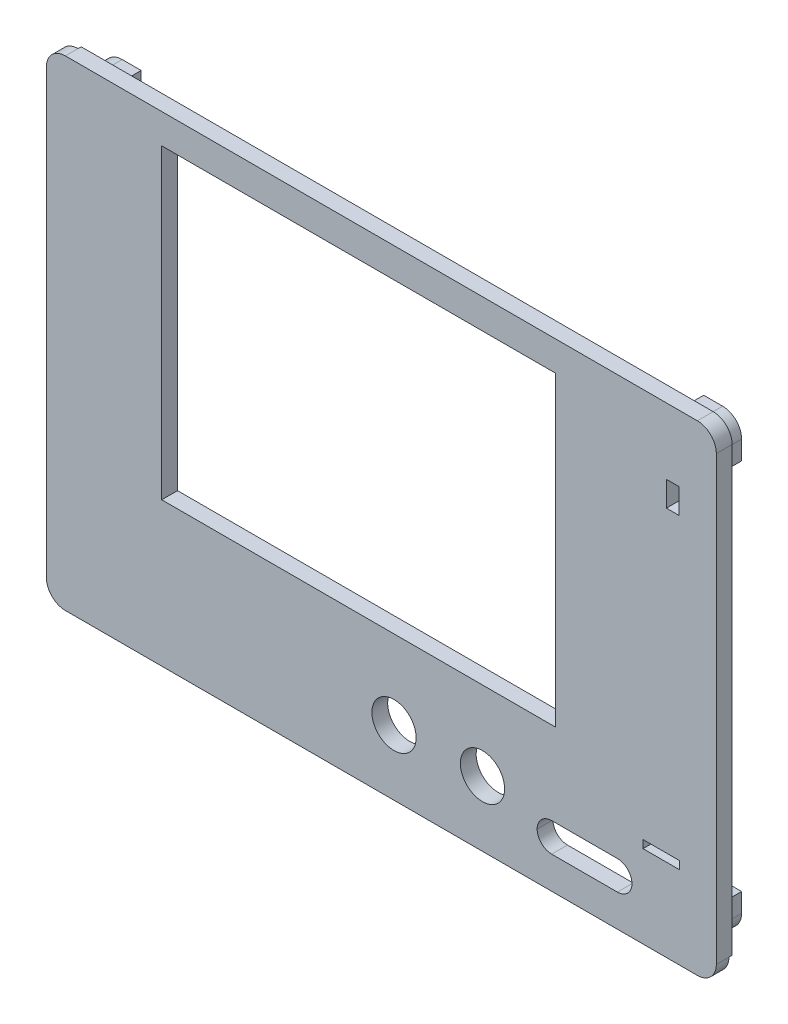
from build123d import *

# Parameters (mm, degrees)
IZIM1_W                     = 106
IZIM1_H                     = 76
IZIM1_R                     = 3.5
Y_KSEKLIK_EKSTR_ZYON2_DEPTH = 2.5
IZIM5_W                     = 62.3
IZIM5_H                     = 48.5
KES_EKSTR_ZYON1_DEPTH       = 2.5
Y_KSEKLIK_EKSTR_ZYON6_DEPTH = 4
RADYUS7_R                   = 3
RADYUS15_R                  = 3
IZIM12_W                    = 15
IZIM12_H                    = 4.6
IZIM12_W_2                  = 5.8
IZIM12_H_2                  = 1.25
IZIM12_W_3                  = 2
IZIM12_H_3                  = 3.95
KES_EKSTR_ZYON3_DEPTH       = 4
RADYUS16_R                  = 2.3
KES_EKSTR_ZYON5_START       = -0.5
KES_EKSTR_ZYON5_DEPTH       = 0.5
RADYUS17_R                  = 1.5


with BuildPart() as part:
    # Çizim1 → Yükseklik-Ekstrüzyon2 (new body)
    with BuildSketch(Plane.XY):
        with Locations((53, 38)):
            Rectangle(IZIM1_W, IZIM1_H)
        with Locations((55, 10.31)):
            Circle(IZIM1_R, mode=Mode.SUBTRACT)
        with Locations((69, 10.31)):
            Circle(IZIM1_R, mode=Mode.SUBTRACT)
    extrude(amount=Y_KSEKLIK_EKSTR_ZYON2_DEPTH)

    # Çizim5 → Kes-Ekstrüzyon1 (cut)
    with BuildSketch(Plane.XY.offset(2.5)):
        with Locations((49.4, 47.05)):
            Rectangle(IZIM5_W, IZIM5_H)
    extrude(amount=-KES_EKSTR_ZYON1_DEPTH, mode=Mode.SUBTRACT)

    # Çizim7 → Yükseklik-Ekstrüzyon6 (add)
    with BuildSketch(Plane(origin=(0, 0, 0), x_dir=(-1, 0, 0), z_dir=(0, 0, -1))):
        Polygon((-103.5, 73.5), (-97.5, 73.5), (-97.5, 71), (-101, 71), (-101, 67.5), (-103.5, 67.5), align=None)
        Polygon((-2.5, 2.5), (-8.5, 2.5), (-8.5, 5), (-5, 5), (-5, 8.5), (-2.5, 8.5), align=None)
        Polygon((-2.5, 67.5), (-2.5, 73.5), (-8.5, 73.5), (-8.5, 71), (-5, 71), (-5, 67.5), align=None)
        Polygon((-103.5, 8.5), (-103.5, 2.5), (-97.5, 2.5), (-97.5, 5), (-101, 5), (-101, 8.5), align=None)
    extrude(amount=Y_KSEKLIK_EKSTR_ZYON6_DEPTH)

    # Radyus7
    radyus7_edges = [part.edges().sort_by_distance(p)[0] for p in [
        (2.5, 2.5, -2),
        (2.5, 73.5, -2),
        (103.5, 2.5, -2),
        (103.5, 73.5, -2),
    ]]
    fillet(radyus7_edges, radius=RADYUS7_R)

    # Radyus15
    radyus15_edges = [part.edges().sort_by_distance(p)[0] for p in [
        (0, 76, 1.25),
        (106, 76, 1.25),
        (106, 0, 1.25),
        (0, 0, 1.25),
    ]]
    fillet(radyus15_edges, radius=RADYUS15_R)

    # Çizim12 → Kes-Ekstrüzyon3 (cut)
    with BuildSketch(Plane.XY.offset(2.5)):
        with Locations((85.15, 7.39)):
            Rectangle(IZIM12_W, IZIM12_H)
        with Locations((97.3, 13.695)):
            Rectangle(IZIM12_W_2, IZIM12_H_2)
        with Locations((99.1, 63.555)):
            Rectangle(IZIM12_W_3, IZIM12_H_3)
    extrude(amount=-KES_EKSTR_ZYON3_DEPTH, mode=Mode.SUBTRACT)

    # Radyus16
    radyus16_edges = [part.edges().sort_by_distance(p)[0] for p in [
        (92.65, 5.09, 1.25),
        (92.65, 9.69, 1.25),
        (77.65, 9.69, 1.25),
        (77.65, 5.09, 1.25),
    ]]
    fillet(radyus16_edges, radius=RADYUS16_R - 0.0001)  # a hair under: the kernel refuses the full size

    # Çizim14 → Kes-Ekstrüzyon5 (cut)
    with BuildSketch(Plane(origin=(0, 0, 0), x_dir=(-1, 0, 0), z_dir=(0, 0, -1)).offset(KES_EKSTR_ZYON5_START)):
        with BuildLine():
            Line((-106, 3), (-105, 3))
            ThreePointArc((-105, 3), (-104.414213562, 1.585786438), (-103, 1))
            Line((-103, 1), (-103, 0))
            ThreePointArc((-103, 0), (-105.121320344, 0.878679656), (-106, 3))
        make_face()
        with BuildLine():
            Line((-3, 1), (-3, 0))
            ThreePointArc((-3, 0), (-0.878679656, 0.878679656), (0, 3))
            Line((0, 3), (-1, 3))
            ThreePointArc((-1, 3), (-1.585786438, 1.585786438), (-3, 1))
        make_face()
        with BuildLine():
            Line((-3, 76), (-3, 75))
            ThreePointArc((-3, 75), (-1.585786438, 74.414213562), (-1, 73))
            Line((-1, 73), (0, 73))
            ThreePointArc((0, 73), (-0.878679656, 75.121320344), (-3, 76))
        make_face()
    extrude(amount=KES_EKSTR_ZYON5_DEPTH, mode=Mode.SUBTRACT)

    # Radyus17
    radyus17_edges = [part.edges().sort_by_distance(p)[0] for p in [
        (3.75, 8.5, 0),
        (5, 6.75, 0),
        (6.75, 5, 0),
        (8.5, 3.75, 0),
        (3.75, 67.5, 0),
        (8.5, 72.25, 0),
        (6.75, 71, 0),
        (5, 69.25, 0),
        (102.25, 8.5, 0),
        (97.5, 3.75, 0),
        (99.25, 5, 0),
        (101, 6.75, 0),
        (102.25, 67.5, 0),
        (101, 69.25, 0),
        (99.25, 71, 0),
        (97.5, 72.25, 0),
    ]]
    fillet(radyus17_edges, radius=RADYUS17_R)


solid = part.part
